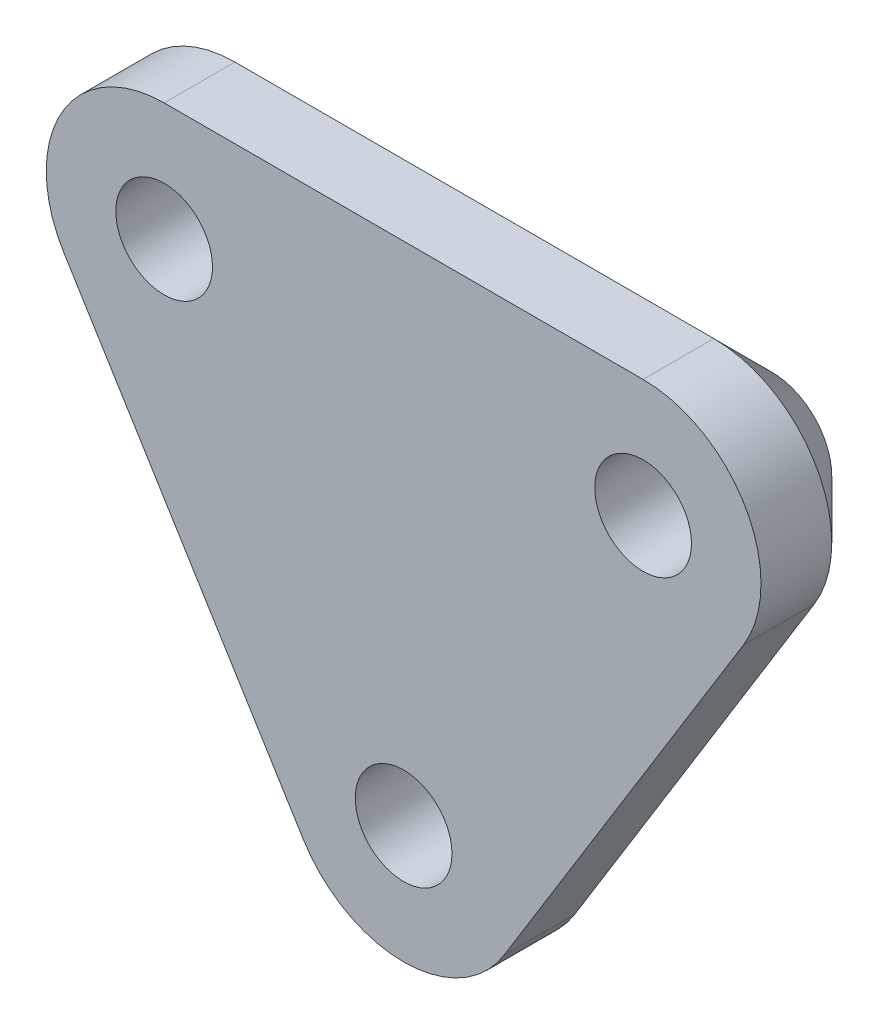
from build123d import *
from build123d.topology import SkipClean

# Parameters (mm, degrees)
SKETCH1_R           = 2.0500000000000003
SKETCH1_R_2         = 2.05
BOSS_EXTRUDE1_DEPTH = 3
BOSS_EXTRUDE2_START = 2.95
SKETCH2_R           = 4.999999999999997
SKETCH2_R_2         = 2.05
SKETCH2_R_3         = 4.999999999999999
SKETCH2_R_4         = 2.0500000000000003
SKETCH2_R_5         = 4.999999999999998
SKETCH2_R_6         = 2.0499999999999985
BOSS_EXTRUDE2_DEPTH = 2.95
CHAMFER1_SIZE       = 2.95
SKETCH3_W           = 37.85330439531782
SKETCH3_H           = 28.758532039103056
CUT_EXTRUDE1_DEPTH  = 0.5


with BuildPart() as part:
    # Sketch1 → Boss-Extrude1 (new body)
    with BuildSketch(Plane.XY):
        with BuildLine():
            Line((-14.411027514700965, 13.845837315616981), (-4.256027514700967, -2.624162684383019))
            ThreePointArc((-4.256027514700967, -2.624162684383019), (3.1e-16, -4.999999999999998), (4.256027514700967, -2.624162684383019))
            Line((4.256027514700967, -2.624162684383019), (14.411027514700965, 13.845837315616981))
            ThreePointArc((14.411027514700965, 13.845837315616981), (14.52082256979799, 18.907128082198888), (10.155000000000001, 21.46999999999999))
            Line((10.155000000000001, 21.46999999999999), (-10.155000000000001, 21.46999999999999))
            ThreePointArc((-10.155000000000001, 21.46999999999999), (-14.520822569797986, 18.907128082198888), (-14.411027514700965, 13.845837315616981))
        make_face()
        with Locations((-10.155, 16.47)):
            Circle(SKETCH1_R, mode=Mode.SUBTRACT)
        with Locations((10.155, 16.47)):
            Circle(SKETCH1_R, mode=Mode.SUBTRACT)
        Circle(SKETCH1_R_2, mode=Mode.SUBTRACT)
    extrude(amount=BOSS_EXTRUDE1_DEPTH)

    # Sketch2 → Boss-Extrude2 (add)
    # profile 1 of 3: a face of its own
    with BuildSketch(Plane(origin=(0, 0, 0), x_dir=(-1, 0, 0), z_dir=(0, 0, -1)).offset(BOSS_EXTRUDE2_START)):
        Circle(SKETCH2_R)
        Circle(SKETCH2_R_2, mode=Mode.SUBTRACT)
    # profile 2 of 3: a face of its own
    with BuildSketch(Plane(origin=(0, 0, 0), x_dir=(-1, 0, 0), z_dir=(0, 0, -1)).offset(BOSS_EXTRUDE2_START)):
        with Locations((10.155, 16.47)):
            Circle(SKETCH2_R_3)
        with Locations((10.155, 16.47)):
            Circle(SKETCH2_R_4, mode=Mode.SUBTRACT)
    # profile 3 of 3: a face of its own
    with BuildSketch(Plane(origin=(0, 0, 0), x_dir=(-1, 0, 0), z_dir=(0, 0, -1)).offset(BOSS_EXTRUDE2_START)):
        with Locations((-10.155, 16.47)):
            Circle(SKETCH2_R_5)
        with Locations((-10.155, 16.47)):
            Circle(SKETCH2_R_6, mode=Mode.SUBTRACT)
    extrude(amount=-BOSS_EXTRUDE2_DEPTH)

    # Chamfer1
    chamfer1_edges = [part.edges().sort_by_distance(p)[0] for p in [
        (4.999999999999997, 6.1e-16, -2.95),
        (-5.155, 16.47, -2.95),
        (15.154999999999998, 16.47, -2.95),
    ]]
    chamfer(chamfer1_edges, length=CHAMFER1_SIZE - 0.0001)  # a hair under: the kernel refuses the full size

    # Sketch3 → Cut-Extrude1 (cut)
    with SkipClean():  # the faces are left unmerged after this step: merging them gives an invalid solid
        with BuildSketch(Plane.XY.offset(-2.95)):
            with Locations((0.24948253346224725, 7.962837236222983)):
                Rectangle(SKETCH3_W, SKETCH3_H)
        extrude(amount=CUT_EXTRUDE1_DEPTH, mode=Mode.SUBTRACT)


solid = part.part
